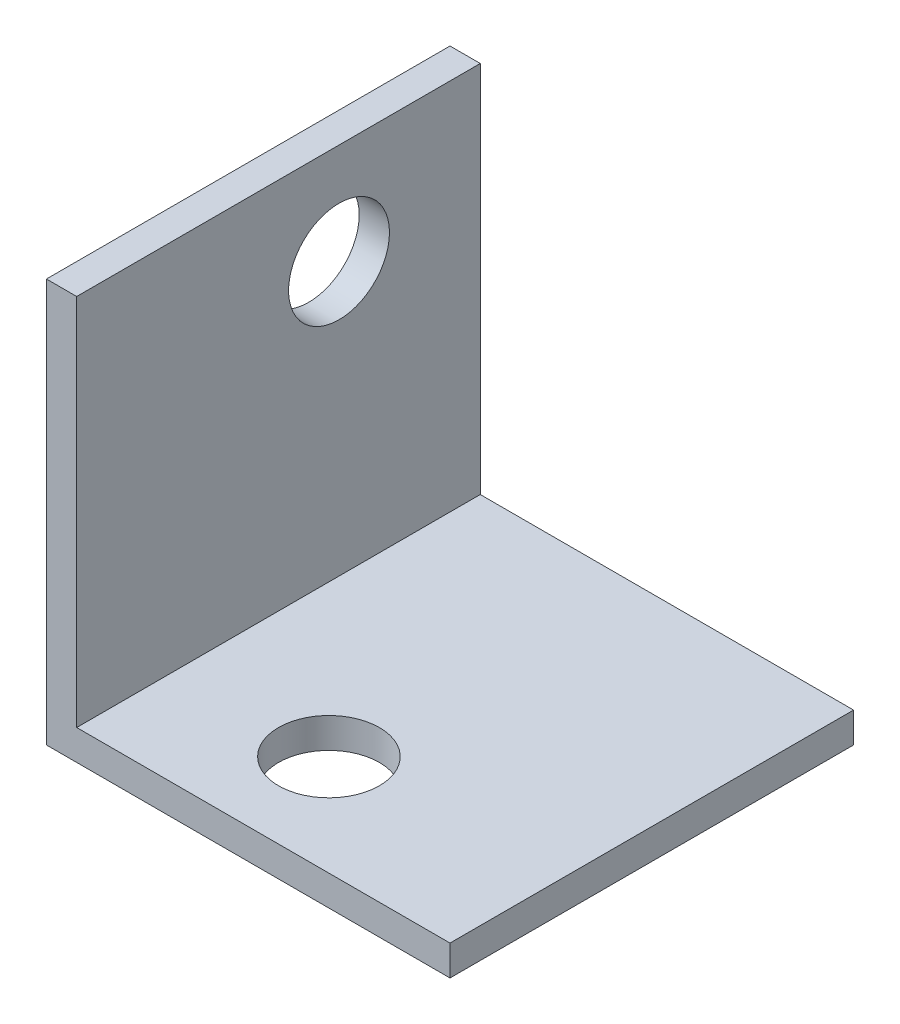
from build123d import *

# Parameters (mm, degrees)
EXTRUDE_THIN1_DEPTH = 20
SKETCH2_R           = 2.5
CUT_EXTRUDE1_DEPTH  = 35.641016151
SKETCH3_R           = 2.5
CUT_EXTRUDE2_DEPTH  = 34.797189232


with BuildPart() as part:
    # Sketch1 → Extrude-Thin1 (new body)
    with BuildSketch(Plane.XY):
        Polygon((0, 20), (0, 0), (20, 0), (20, 1.5), (1.5, 1.5), (1.5, 20), align=None)
    extrude(amount=EXTRUDE_THIN1_DEPTH)

    # Sketch2 → Cut-Extrude1 (cut, through all)
    with BuildSketch(Plane(origin=(0, 0, 0), x_dir=(-1, 0, 0), z_dir=(0, -1, 0))):
        with Locations((-9, -15)):
            Circle(SKETCH2_R)
    extrude(amount=-CUT_EXTRUDE1_DEPTH, mode=Mode.SUBTRACT)

    # Sketch3 → Cut-Extrude2 (cut, through all)
    with BuildSketch(Plane(origin=(1.5, 0, 0), x_dir=(0, 0, -1), z_dir=(1, 0, 0))):
        with Locations((-7, 15)):
            Circle(SKETCH3_R)
    extrude(amount=-CUT_EXTRUDE2_DEPTH, mode=Mode.SUBTRACT)


solid = part.part
